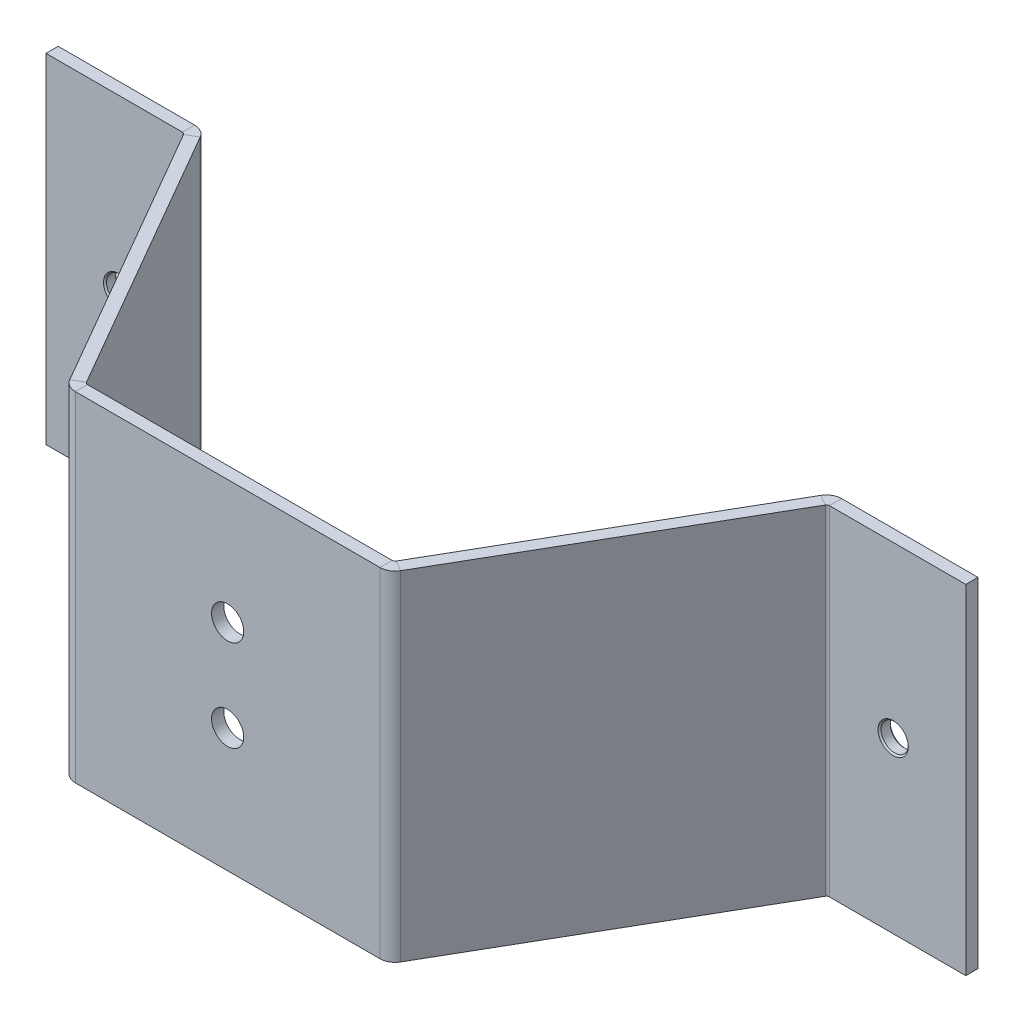
from build123d import *

# Parameters (mm, degrees)
BASE_FLANGE1_DEPTH                    = 22.225
F_28_0_1405_DIAMETER_HOLE1_AT_2_COUNT = 2
F_28_0_1405_DIAMETER_HOLE1_AT_2_PITCH = 101.6
F_19_0_166_DIAMETER_HOLE1_D           = 4.2164


# Sheet-metal steps are written as plain solids
with BuildPart() as part:
    # Sketch2 → Base-Flange1 (new, symmetric)
    with BuildSketch(Plane(origin=(0, 0, 0), x_dir=(1, 0, 0), z_dir=(0, 1, 0))):
        with BuildLine():
            Line((60.325, 0), (42.418846353, 0))
            ThreePointArc((42.418846353, 0), (41.428246353, -0.26543047), (40.703076823, -0.9906))
            Line((40.703076823, -0.9906), (20.311815871, -36.3093))
            ThreePointArc((20.311815871, -36.3093), (20.172360192, -36.448755679), (19.981860192, -36.4998))
            Line((19.981860192, -36.4998), (-19.981860192, -36.4998))
            ThreePointArc((-19.981860192, -36.4998), (-20.172360192, -36.448755679), (-20.311815871, -36.3093))
            Line((-20.311815871, -36.3093), (-40.703076823, -0.9906))
            ThreePointArc((-40.703076823, -0.9906), (-41.428246353, -0.26543047), (-42.418846353, 0))
            Line((-42.418846353, 0), (-60.325, 0))
            Line((-60.325, 0), (-60.325, -1.6002))
            Line((-60.325, -1.6002), (-42.418846353, -1.6002))
            ThreePointArc((-42.418846353, -1.6002), (-42.228346353, -1.651244321), (-42.088890674, -1.7907))
            Line((-42.088890674, -1.7907), (-21.697629722, -37.1094))
            ThreePointArc((-21.697629722, -37.1094), (-20.972460192, -37.83456953), (-19.981860192, -38.1))
            Line((-19.981860192, -38.1), (19.981860192, -38.1))
            ThreePointArc((19.981860192, -38.1), (20.972460192, -37.83456953), (21.697629722, -37.1094))
            Line((21.697629722, -37.1094), (42.088890674, -1.7907))
            ThreePointArc((42.088890674, -1.7907), (42.228346353, -1.651244321), (42.418846353, -1.6002))
            Line((42.418846353, -1.6002), (60.325, -1.6002))
            Line((60.325, -1.6002), (60.325, 0))
        make_face()
    extrude(amount=BASE_FLANGE1_DEPTH, both=True)

    # Sketch4 → #28 (0.1405) Diameter Hole1 (revolve, cut)
    with BuildSketch(Plane(origin=(50.8, 0, 1.6002), x_dir=(0, -1, 0), z_dir=(1, 0, 0))):
        Polygon((0, 0), (0, 1.6002), (1.9812, 1.6002), (1.78435, 1.40335), (1.78435, 0.19685), (1.9812, 0), align=None)
    f_28_0_1405_diameter_hole1 = revolve(axis=Axis((50.8, 0, 7.9502), (0, 0, -1)), mode=Mode.SUBTRACT)

    # #28 (0.1405) Diameter Hole1 at 2: #28 (0.1405) Diameter Hole1 ×2
    with Locations(*[(-i * F_28_0_1405_DIAMETER_HOLE1_AT_2_PITCH, 0, 0) for i in range(1, F_28_0_1405_DIAMETER_HOLE1_AT_2_COUNT)]):
        add(f_28_0_1405_diameter_hole1, mode=Mode.SUBTRACT)

    # #19 (0.166) Diameter Hole1 (through all)
    with Locations(Plane.XY.offset(38.1)):
        with Locations((0, 5.9944), (0, -5.9944)):
            Hole(F_19_0_166_DIAMETER_HOLE1_D / 2)


solid = part.part
